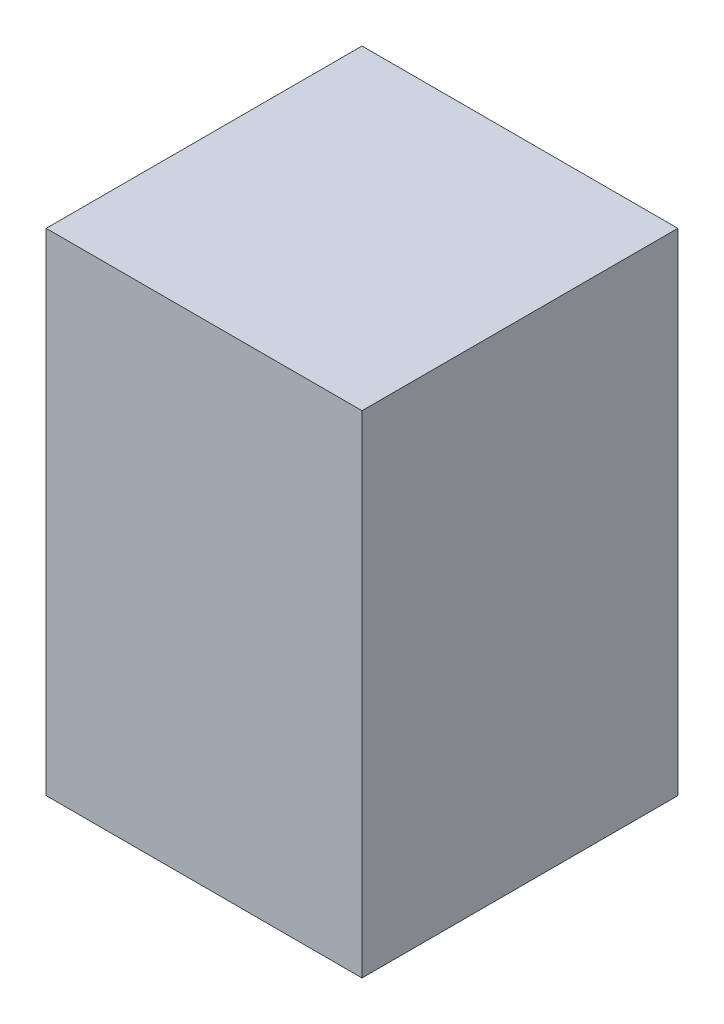
from build123d import *

# Parameters (mm, degrees)
BOSS_EXTRUDE1_DEPTH      = 44.45
BOSS_EXTRUDE1_DEPTH_BACK = 44.45
SKETCH1_W                = 57.15
SKETCH1_H                = 57.15


with BuildPart() as part:
    # Sketch1 → Boss-Extrude1 (new, two sides: drawn at the far end of the back side and taken through both)
    with BuildSketch(Plane(origin=(0, 0, 0), x_dir=(1, 0, 0), z_dir=(0, 1, 0)).offset(-BOSS_EXTRUDE1_DEPTH_BACK)):
        Rectangle(SKETCH1_W, SKETCH1_H)
    extrude(amount=BOSS_EXTRUDE1_DEPTH + BOSS_EXTRUDE1_DEPTH_BACK)


solid = part.part
